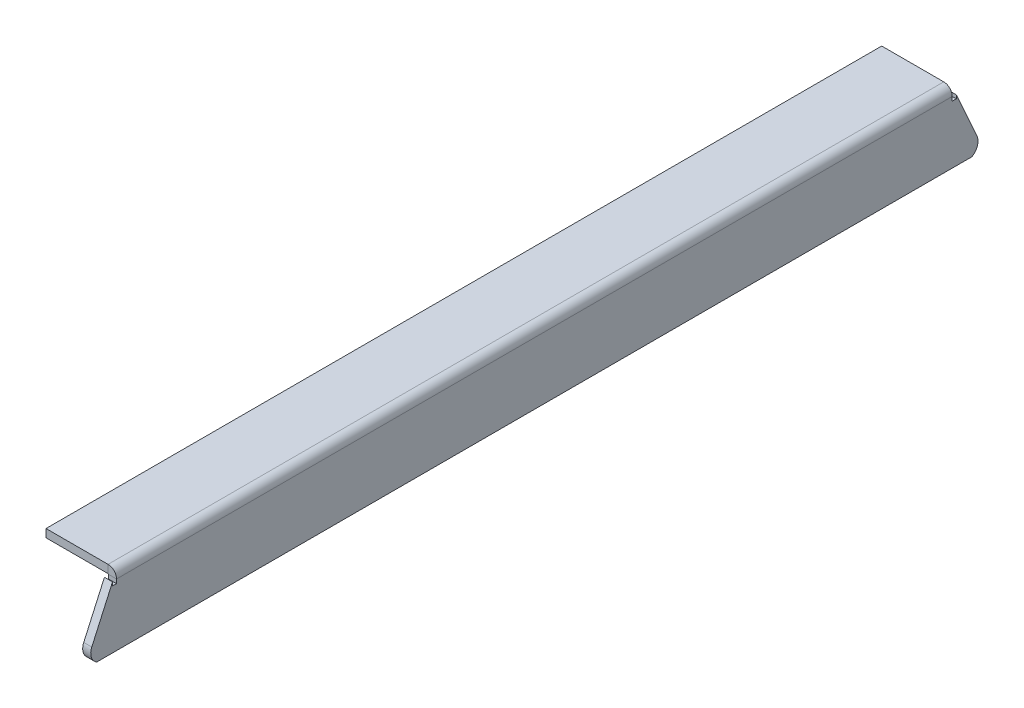
from build123d import *

# Parameters (mm, degrees)
BASE_FLANGE1_DEPTH            = 4
EDGE_FLANGE1_STRIP_W          = 16.4
EDGE_FLANGE1_STRIP_H          = 4
EDGE_FLANGE1_STRIP_CUT_DEPTH  = 414.766345977
EDGE_FLANGE1_RELIEF_W         = 18.4
EDGE_FLANGE1_RELIEF_H         = 2
EDGE_FLANGE1_RELIEF_CUT_DEPTH = 4
EDGE_FLANGE1_DEPTH            = 414.766345977


# Sheet-metal steps are written as plain solids
with BuildPart() as part:
    # Sketch1 → Base-Flange1 (new body)
    with BuildSketch(Plane(origin=(0, 0, 0), x_dir=(0, 0, -1), z_dir=(1, 0, 0))):
        with BuildLine():
            Line((175.194547185, 25.010679354), (-239.571798792, 25.010679354))
            Line((-239.571798792, 25.010679354), (-251.844435082, -2.304137004))
            ThreePointArc((-251.844435082, -2.304137004), (-252.071577805, -6.636355429), (-249.318881936, -9.989320646))
            Line((-249.318881936, -9.989320646), (184.941630328, -9.989320646))
            ThreePointArc((184.941630328, -9.989320646), (187.694326197, -6.636355429), (187.467183475, -2.304137004))
            Line((187.467183475, -2.304137004), (175.194547185, 25.010679354))
        make_face()
    extrude(amount=-BASE_FLANGE1_DEPTH)

    # Edge-Flange1 strip (across the edge) → Edge-Flange1 strip cut (cut)
    with BuildSketch(Plane(origin=(-4, 25.010679354, 239.571798792), x_dir=(0, -1, 0), z_dir=(0, 0, -1))):
        with Locations((-4, -2)):
            Rectangle(EDGE_FLANGE1_STRIP_W, EDGE_FLANGE1_STRIP_H)
    extrude(amount=EDGE_FLANGE1_STRIP_CUT_DEPTH, mode=Mode.SUBTRACT)

    # Edge-Flange1 relief (on the sheet) → Edge-Flange1 relief cut (cut)
    with BuildSketch(Plane(origin=(-4, 20.810679354, 239.571798792), x_dir=(0, -1, 0), z_dir=(-1, 0, 0))):
        with Locations((-7.2, 1)):
            Rectangle(EDGE_FLANGE1_RELIEF_W, EDGE_FLANGE1_RELIEF_H)
        with Locations((-7.2, -415.766345977)):
            Rectangle(EDGE_FLANGE1_RELIEF_W, EDGE_FLANGE1_RELIEF_H)
    extrude(amount=-EDGE_FLANGE1_RELIEF_CUT_DEPTH, mode=Mode.SUBTRACT)

    # Edge-Flange1 section (across the edge) → Edge-Flange1 (add)
    with BuildSketch(Plane(origin=(-4, 25.010679354, 239.571798792), x_dir=(0, -1, 0), z_dir=(0, 0, -1))):
        with BuildLine():
            Line((0, 0.2), (0, 31))
            Line((0, 31), (4, 31))
            Line((4, 31), (4, 0.2))
            ThreePointArc((4, 0.2), (4.058578644, 0.058578644), (4.2, 0))
            Line((4.2, 0), (4.2, -4))
            ThreePointArc((4.2, -4), (1.230151519, -2.769848481), (0, 0.2))
        make_face()
    extrude(amount=EDGE_FLANGE1_DEPTH)


solid = part.part
